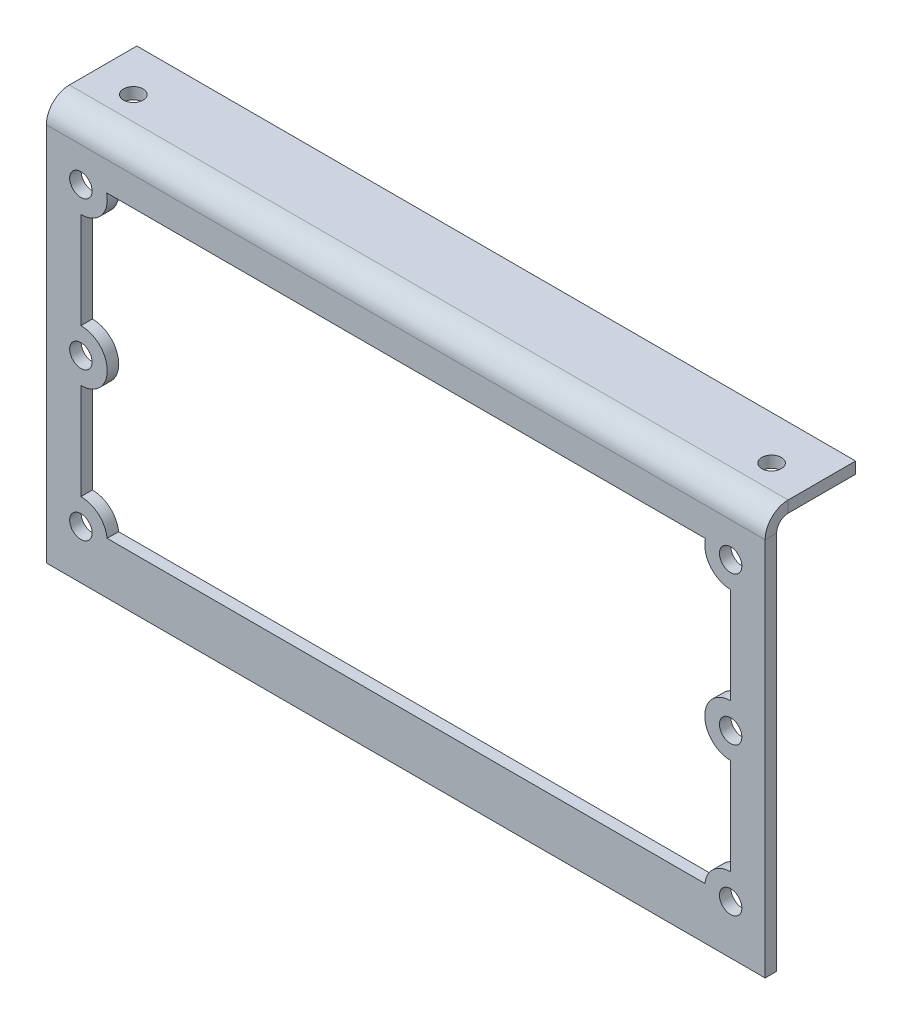
from build123d import *

# Parameters (mm, degrees)
SKETCH3_W                    = 125
SKETCH3_H                    = 70
BASE_FLANGE1_DEPTH           = 2
EDGE_FLANGE2_STRIP_W         = 12
EDGE_FLANGE2_STRIP_H         = 2
EDGE_FLANGE2_STRIP_CUT_DEPTH = 125
EDGE_FLANGE2_DEPTH           = 125
SKETCH18_W                   = 113
SKETCH18_H                   = 52
CUT_EXTRUDE3_DEPTH           = 10
SKETCH23_R                   = 4.5
BOSS_EXTRUDE1_DEPTH          = 2
PSU_BRACKET_MB_HOLES_D       = 3.4
M3_5_CLEARANCE_HOLE1_D       = 3.9


# Sheet-metal steps are written as plain solids
with BuildPart() as part:
    # Sketch3 → Base-Flange1 (new body)
    with BuildSketch(Plane.XY):
        with Locations((-0.781098762, 13.552360409)):
            Rectangle(SKETCH3_W, SKETCH3_H)
    extrude(amount=-BASE_FLANGE1_DEPTH)

    # Edge-Flange2 strip (across the edge) → Edge-Flange2 strip cut (cut)
    with BuildSketch(Plane(origin=(-63.281098762, 48.552360409, -2), x_dir=(0, -1, 0), z_dir=(1, 0, 0))):
        with Locations((-2, -1)):
            Rectangle(EDGE_FLANGE2_STRIP_W, EDGE_FLANGE2_STRIP_H)
    extrude(amount=EDGE_FLANGE2_STRIP_CUT_DEPTH, mode=Mode.SUBTRACT)

    # Edge-Flange2 section (across the edge) → Edge-Flange2 (add)
    with BuildSketch(Plane(origin=(-63.281098762, 48.552360409, -2), x_dir=(0, -1, 0), z_dir=(1, 0, 0))):
        with BuildLine():
            Line((0, 2), (0, 13.7366))
            Line((0, 13.7366), (2, 13.7366))
            Line((2, 13.7366), (2, 2))
            ThreePointArc((2, 2), (2.585786438, 0.585786438), (4, 0))
            Line((4, 0), (4, -2))
            ThreePointArc((4, -2), (1.171572875, -0.828427125), (0, 2))
        make_face()
    extrude(amount=EDGE_FLANGE2_DEPTH)

    # Sketch18 → Cut-Extrude3 (cut)
    with BuildSketch(Plane(origin=(-99.752621101, 247.510324645, -2), x_dir=(1, 0, 0), z_dir=(0, 0, -1))):
        with Locations((98.971522339, 233.957964235)):
            Rectangle(SKETCH18_W, SKETCH18_H)
    extrude(amount=-CUT_EXTRUDE3_DEPTH, mode=Mode.SUBTRACT)

    # Sketch23 → Boss-Extrude1 (add)
    with BuildSketch(Plane.XY):
        with Locations((-57.191455267, 12.802360409)):
            Circle(SKETCH23_R)
        with Locations((-57.191455267, -12.947639591)):
            Circle(SKETCH23_R)
        with Locations((55.718901238, -12.947639591)):
            Circle(SKETCH23_R)
        with Locations((55.718901238, 12.802360409)):
            Circle(SKETCH23_R)
        with Locations((-57.191455267, 38.552360409)):
            Circle(SKETCH23_R)
        with Locations((55.718901238, 38.552360409)):
            Circle(SKETCH23_R)
    extrude(amount=-BOSS_EXTRUDE1_DEPTH)

    # PSU bracket MB holes (through all)
    with Locations(Plane(origin=(-99.752621101, 40.552360409, 598.492474399), x_dir=(1, 0, 0), z_dir=(0, -1, 0))):
        with Locations((43.471522339, -606.610908499), (154.471522339, -606.610908499)):
            Hole(PSU_BRACKET_MB_HOLES_D / 2)

    # M3.5 Clearance Hole1 (through all)
    with Locations(Plane(origin=(-98.752621101, 247.510324645, -2), x_dir=(1, 0, 0), z_dir=(0, 0, -1))):
        with Locations((41.471522339, 260.457964235), (41.471522339, 234.707964235), (41.471522339, 208.957964235), (154.471522339, 208.957964235), (154.471522339, 234.707964235), (154.471522339, 260.457964235)):
            Hole(M3_5_CLEARANCE_HOLE1_D / 2)


solid = part.part
